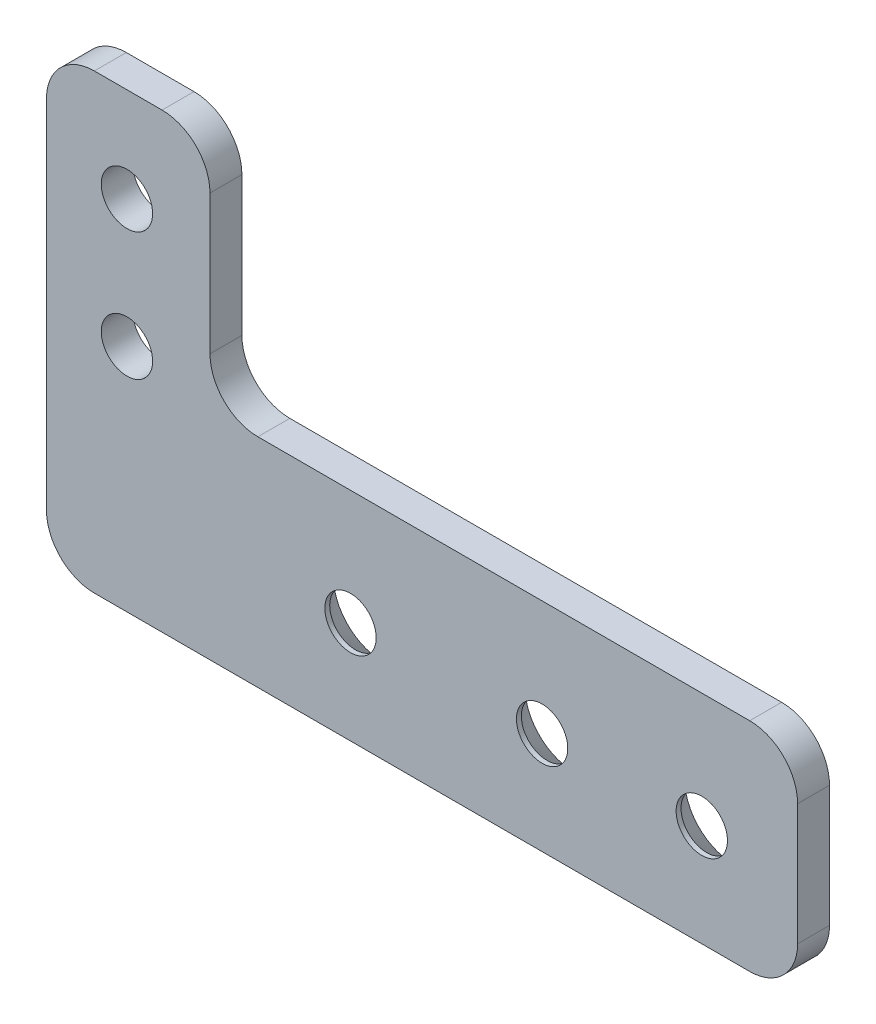
from build123d import *

# Parameters (mm, degrees)
SKETCH1_R                                    = 2.5527
BOSS_EXTRUDE1_DEPTH                          = 3.175
FILLET1_R                                    = 4.7625
CSK_FOR_10_FLAT_HEAD_MACHINE_SCREW3_AT_COUNT = 2
CSK_FOR_10_FLAT_HEAD_MACHINE_SCREW3_AT_PITCH = 15.875
CSK_FOR_10_FLAT_HEAD_MACHINE_SCREW3_2_COUNT  = 2
CSK_FOR_10_FLAT_HEAD_MACHINE_SCREW3_2_PITCH  = 34.925


with BuildPart() as part:
    # Sketch1 → Boss-Extrude1 (new body)
    with BuildSketch(Plane.XY):
        Polygon((-33.401, 23.749), (-33.401, -21.209), (41.275, -21.209), (41.275, 0.381), (-17.145, 0.381), (-17.145, 23.749), align=None)
        with Locations((-25.4, 1.651)):
            Circle(SKETCH1_R, mode=Mode.SUBTRACT)
        with Locations((-25.4, 14.351)):
            Circle(SKETCH1_R, mode=Mode.SUBTRACT)
    extrude(amount=BOSS_EXTRUDE1_DEPTH)

    # Fillet1
    fillet1_edges = [part.edges().sort_by_distance(p)[0] for p in [
        (-33.401, 23.749, 1.5875),
        (-17.145, 23.749, 1.5875),
        (-17.145, 0.381, 1.5875),
        (41.275, 0.381, 1.5875),
        (41.275, -21.209, 1.5875),
        (-33.401, -21.209, 1.5875),
    ]]
    fillet(fillet1_edges, radius=FILLET1_R)

    # Sketch7 → CSK for #10 Flat Head Machine Screw3 (revolve, cut)
    with BuildSketch(Plane(origin=(31.75, -11.049, 0), x_dir=(0, 1, 0), z_dir=(1, 0, 0))):
        Polygon((0, 0), (0, 3.175), (2.5527, 3.175), (2.5527, 2.688180894), (4.8895, 0), align=None)
    csk_for_10_flat_head_machine_screw3 = revolve(axis=Axis((31.75, -11.049, -6.35), (0, 0, 1)), mode=Mode.SUBTRACT)

    # CSK for #10 Flat Head Machine Screw3 at: CSK for #10 Flat Head Machine Screw3 ×2
    with Locations(*[(-i * CSK_FOR_10_FLAT_HEAD_MACHINE_SCREW3_AT_PITCH, 0, 0) for i in range(1, CSK_FOR_10_FLAT_HEAD_MACHINE_SCREW3_AT_COUNT)]):
        add(csk_for_10_flat_head_machine_screw3, mode=Mode.SUBTRACT)

    # CSK for _10 Flat Head Machine Screw3 2: CSK for #10 Flat Head Machine Screw3 ×2
    with Locations(*[(-i * CSK_FOR_10_FLAT_HEAD_MACHINE_SCREW3_2_PITCH, 0, 0) for i in range(1, CSK_FOR_10_FLAT_HEAD_MACHINE_SCREW3_2_COUNT)]):
        add(csk_for_10_flat_head_machine_screw3, mode=Mode.SUBTRACT)


solid = part.part
